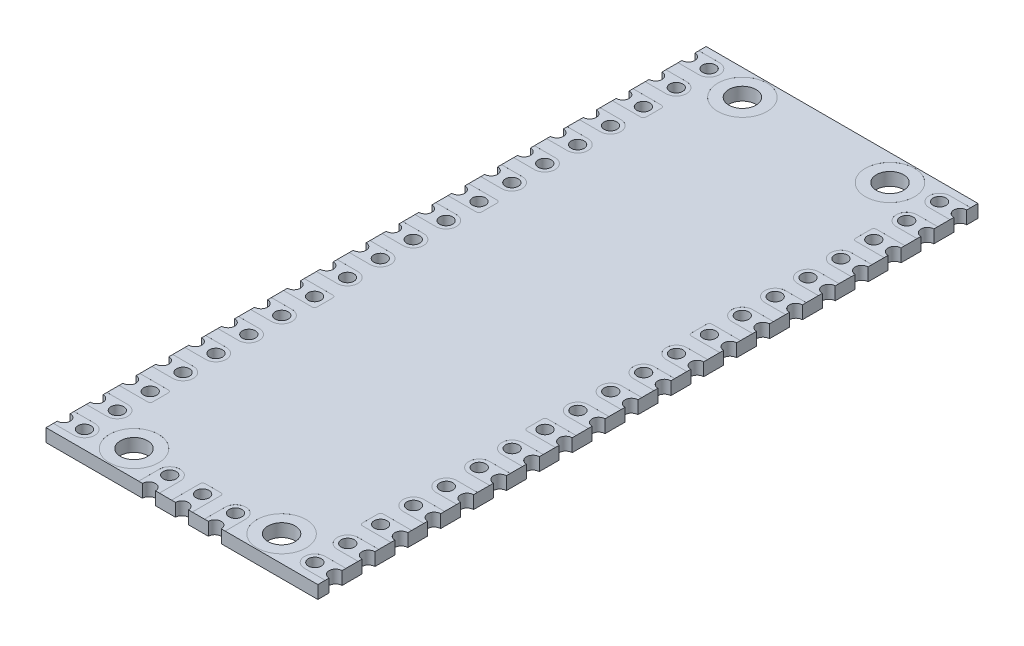
from build123d import *

# Parameters (mm, degrees)
BASES_W                        = 21
BASES_H                        = 51
BASE_DEPTH                     = 0.5
F_1_0_1_DIAMETER_HOLE1_D       = 1
HOLEHORZLP_COUNT               = 2
HOLEHORZLP_PITCH               = 1.6
SLOTCUT_DEPTH                  = 0.001
HOLEHORZLPSLOTLP_COUNT         = 20
HOLEHORZLPSLOTLP_PITCH         = 2.54
HOLEHORZLPSLOTLP_COPY_1_D      = 1
HOLEHORZLPSLOTLP_COPY_2_D      = 1
HOLEHORZLPSLOTLP_COPY_3_D      = 1
HOLEHORZLPSLOTLP_COPY_4_D      = 1
HOLEHORZLPSLOTLP_COPY_5_D      = 1
HOLEHORZLPSLOTLP_COPY_6_D      = 1
HOLEHORZLPSLOTLP_COPY_7_D      = 1
HOLEHORZLPSLOTLP_COPY_8_D      = 1
HOLEHORZLPSLOTLP_COPY_9_D      = 1
HOLEHORZLPSLOTLP_COPY_10_D     = 1
HOLEHORZLPSLOTLP_COPY_11_D     = 1
HOLEHORZLPSLOTLP_COPY_12_D     = 1
HOLEHORZLPSLOTLP_COPY_13_D     = 1
HOLEHORZLPSLOTLP_COPY_14_D     = 1
HOLEHORZLPSLOTLP_COPY_15_D     = 1
HOLEHORZLPSLOTLP_COPY_16_D     = 1
HOLEHORZLPSLOTLP_COPY_17_D     = 1
HOLEHORZLPSLOTLP_COPY_18_D     = 1
HOLEHORZLPSLOTLP_COPY_19_D     = 1
SHLPHM_COPY_1_D                = 1
SHLPHM_COPY_2_D                = 1
SHLPHM_COPY_3_D                = 1
SHLPHM_COPY_4_D                = 1
SHLPHM_COPY_5_D                = 1
SHLPHM_COPY_6_D                = 1
SHLPHM_COPY_7_D                = 1
SHLPHM_COPY_8_D                = 1
SHLPHM_COPY_9_D                = 1
SHLPHM_COPY_10_D               = 1
SHLPHM_COPY_11_D               = 1
SHLPHM_COPY_12_D               = 1
SHLPHM_COPY_13_D               = 1
SHLPHM_COPY_14_D               = 1
SHLPHM_COPY_15_D               = 1
SHLPHM_COPY_16_D               = 1
SHLPHM_COPY_17_D               = 1
SHLPHM_COPY_18_D               = 1
SHLPHM_COPY_19_D               = 1
SHLPHM_COPY_20_D               = 1
SHLPHM_COPY_21_DEPTH           = 0.001
SHLPHM_COPY_22_DEPTH           = 0.001
SHLPHM_COPY_23_DEPTH           = 0.001
SHLPHM_COPY_24_DEPTH           = 0.001
SHLPHM_COPY_25_DEPTH           = 0.001
SHLPHM_COPY_26_DEPTH           = 0.001
SHLPHM_COPY_27_DEPTH           = 0.001
SHLPHM_COPY_28_DEPTH           = 0.001
SHLPHM_COPY_29_DEPTH           = 0.001
SHLPHM_COPY_30_DEPTH           = 0.001
SHLPHM_COPY_31_DEPTH           = 0.001
SHLPHM_COPY_32_DEPTH           = 0.001
SHLPHM_COPY_33_DEPTH           = 0.001
SHLPHM_COPY_34_DEPTH           = 0.001
SHLPHM_COPY_35_DEPTH           = 0.001
SHLPHM_COPY_36_DEPTH           = 0.001
SHLPHM_COPY_37_DEPTH           = 0.001
SHLPHM_COPY_38_DEPTH           = 0.001
SHLPHM_COPY_39_DEPTH           = 0.001
SHLPHM_COPY_40_D               = 1
SHLPHM_COPY_41_D               = 1
SHLPHM_COPY_42_D               = 1
SHLPHM_COPY_43_D               = 1
SHLPHM_COPY_44_D               = 1
SHLPHM_COPY_45_D               = 1
SHLPHM_COPY_46_D               = 1
SHLPHM_COPY_47_D               = 1
SHLPHM_COPY_48_D               = 1
SHLPHM_COPY_49_D               = 1
SHLPHM_COPY_50_D               = 1
SHLPHM_COPY_51_D               = 1
SHLPHM_COPY_52_D               = 1
SHLPHM_COPY_53_D               = 1
SHLPHM_COPY_54_D               = 1
SHLPHM_COPY_55_D               = 1
SHLPHM_COPY_56_D               = 1
SHLPHM_COPY_57_D               = 1
SHLPHM_COPY_58_D               = 1
F_2_1_2_1_DIAMETER_HOLE1_D     = 2.1
SOLDERING2_1MMHOLECUTOUTS_R    = 1.9
SOLDERING2_1MMHOLECUTOUT_DEPTH = 0.001
SHCHMVM_COPY_1_D               = 2.1
SHCHMVM_COPY_2_SKETCH_R        = 1.9
SHCHMVM_COPY_2_DEPTH           = 0.001
SHCTOPVM_COPY_1_D              = 2.1
SHCTOPVM_COPY_2_SKETCH_R       = 1.9
SHCTOPVM_COPY_2_DEPTH          = 0.001
SHCTOPVM_COPY_3_D              = 2.1
SHCTOPVM_COPY_4_D              = 2.1
SHCTOPVM_COPY_5_SKETCH_R       = 1.9
SHCTOPVM_COPY_5_DEPTH          = 0.001
SHCTOPVM_COPY_6_D              = 2.1
SHCTOPVM_COPY_7_SKETCH_R       = 1.9
SHCTOPVM_COPY_7_DEPTH          = 0.001
SHCTOPVM_COPY_8_D              = 2.1
SQUAREETCH_DEPTH               = 0.001
SELP_COUNT                     = 4
SELP_PITCH                     = 12.7
SELPHM_COPY_1_DEPTH            = 0.001
SELPHM_COPY_2_DEPTH            = 0.001
SELPHM_COPY_3_DEPTH            = 0.001
F_1_0_1_DIAMETER_HOLE2_D       = 1
VERTICALSLOTCUT_START          = -0.001
VERTICALSLOTCUT_DEPTH          = 0.001
DH2LP_COUNT                    = 2
DH2LP_PITCH                    = 1.6
VSCHLP_COUNT                   = 2
VSCHLP_PITCH                   = 2.54
VSCHLP_COPY_1_D                = 1
VSCHLP_COL_COUNT               = 2
VSCHLP_COL_PITCH               = 2.54
VSCHLP_COL_COPY_1_D            = 1
VERTICALSQUAREETCH_DEPTH       = 0.001
VSCHPVM_DEPTH                  = 0.001


with BuildPart() as part:
    # BaseS → Base (new, symmetric)
    with BuildSketch(Plane(origin=(0, 0, 0), x_dir=(1, 0, 0), z_dir=(0, 1, 0))):
        Rectangle(BASES_W, BASES_H)
    extrude(amount=BASE_DEPTH, both=True)

    # Ø1.0 (1) Diameter Hole1 (through all)
    with Locations(Plane(origin=(0, 0.5, 0), x_dir=(1, 0, 0), z_dir=(0, 1, 0))):
        with Locations((-8.9, -24.13)):
            f_1_0_1_diameter_hole1 = Hole(F_1_0_1_DIAMETER_HOLE1_D / 2)

    # HoleHorzLP: Ø1.0 (1) Diameter Hole1 ×2
    with Locations(*[(-i * HOLEHORZLP_PITCH, 0, 0) for i in range(1, HOLEHORZLP_COUNT)]):
        add(f_1_0_1_diameter_hole1, mode=Mode.SUBTRACT)

    # SlotCutS → SlotCut (cut)
    with BuildSketch(Plane(origin=(0, 0.5, 0), x_dir=(1, 0, 0), z_dir=(0, 1, 0))):
        with BuildLine():
            Line((-8.9, -24.93), (-10.5, -24.93))
            ThreePointArc((-10.5, -24.93), (-11.3, -24.13), (-10.5, -23.33))
            Line((-10.5, -23.33), (-8.9, -23.33))
            ThreePointArc((-8.9, -23.33), (-8.1, -24.13), (-8.9, -24.93))
        make_face()
    slotcut = extrude(amount=-SLOTCUT_DEPTH, mode=Mode.SUBTRACT)

    # HoleHorzLPSlotLP: Ø1.0 (1) Diameter Hole1, SlotCut ×20
    with Locations(*[(0, 0, -i * HOLEHORZLPSLOTLP_PITCH) for i in range(1, HOLEHORZLPSLOTLP_COUNT)]):
        add(f_1_0_1_diameter_hole1, mode=Mode.SUBTRACT)
        add(slotcut, mode=Mode.SUBTRACT)

    # HoleHorzLPSlotLP copy 1 (through all)
    with Locations(Plane(origin=(-1.6, 0.5, -2.54), x_dir=(1, 0, 0), z_dir=(0, 1, 0))):
        with Locations((-8.9, -24.13)):
            Hole(HOLEHORZLPSLOTLP_COPY_1_D / 2)

    # HoleHorzLPSlotLP copy 2 (through all)
    with Locations(Plane(origin=(-1.6, 0.5, -5.08), x_dir=(1, 0, 0), z_dir=(0, 1, 0))):
        with Locations((-8.9, -24.13)):
            Hole(HOLEHORZLPSLOTLP_COPY_2_D / 2)

    # HoleHorzLPSlotLP copy 3 (through all)
    with Locations(Plane(origin=(-1.6, 0.5, -7.62), x_dir=(1, 0, 0), z_dir=(0, 1, 0))):
        with Locations((-8.9, -24.13)):
            Hole(HOLEHORZLPSLOTLP_COPY_3_D / 2)

    # HoleHorzLPSlotLP copy 4 (through all)
    with Locations(Plane(origin=(-1.6, 0.5, -10.16), x_dir=(1, 0, 0), z_dir=(0, 1, 0))):
        with Locations((-8.9, -24.13)):
            Hole(HOLEHORZLPSLOTLP_COPY_4_D / 2)

    # HoleHorzLPSlotLP copy 5 (through all)
    with Locations(Plane(origin=(-1.6, 0.5, -12.7), x_dir=(1, 0, 0), z_dir=(0, 1, 0))):
        with Locations((-8.9, -24.13)):
            Hole(HOLEHORZLPSLOTLP_COPY_5_D / 2)

    # HoleHorzLPSlotLP copy 6 (through all)
    with Locations(Plane(origin=(-1.6, 0.5, -15.24), x_dir=(1, 0, 0), z_dir=(0, 1, 0))):
        with Locations((-8.9, -24.13)):
            Hole(HOLEHORZLPSLOTLP_COPY_6_D / 2)

    # HoleHorzLPSlotLP copy 7 (through all)
    with Locations(Plane(origin=(-1.6, 0.5, -17.78), x_dir=(1, 0, 0), z_dir=(0, 1, 0))):
        with Locations((-8.9, -24.13)):
            Hole(HOLEHORZLPSLOTLP_COPY_7_D / 2)

    # HoleHorzLPSlotLP copy 8 (through all)
    with Locations(Plane(origin=(-1.6, 0.5, -20.32), x_dir=(1, 0, 0), z_dir=(0, 1, 0))):
        with Locations((-8.9, -24.13)):
            Hole(HOLEHORZLPSLOTLP_COPY_8_D / 2)

    # HoleHorzLPSlotLP copy 9 (through all)
    with Locations(Plane(origin=(-1.6, 0.5, -22.86), x_dir=(1, 0, 0), z_dir=(0, 1, 0))):
        with Locations((-8.9, -24.13)):
            Hole(HOLEHORZLPSLOTLP_COPY_9_D / 2)

    # HoleHorzLPSlotLP copy 10 (through all)
    with Locations(Plane(origin=(-1.6, 0.5, -25.4), x_dir=(1, 0, 0), z_dir=(0, 1, 0))):
        with Locations((-8.9, -24.13)):
            Hole(HOLEHORZLPSLOTLP_COPY_10_D / 2)

    # HoleHorzLPSlotLP copy 11 (through all)
    with Locations(Plane(origin=(-1.6, 0.5, -27.94), x_dir=(1, 0, 0), z_dir=(0, 1, 0))):
        with Locations((-8.9, -24.13)):
            Hole(HOLEHORZLPSLOTLP_COPY_11_D / 2)

    # HoleHorzLPSlotLP copy 12 (through all)
    with Locations(Plane(origin=(-1.6, 0.5, -30.48), x_dir=(1, 0, 0), z_dir=(0, 1, 0))):
        with Locations((-8.9, -24.13)):
            Hole(HOLEHORZLPSLOTLP_COPY_12_D / 2)

    # HoleHorzLPSlotLP copy 13 (through all)
    with Locations(Plane(origin=(-1.6, 0.5, -33.02), x_dir=(1, 0, 0), z_dir=(0, 1, 0))):
        with Locations((-8.9, -24.13)):
            Hole(HOLEHORZLPSLOTLP_COPY_13_D / 2)

    # HoleHorzLPSlotLP copy 14 (through all)
    with Locations(Plane(origin=(-1.6, 0.5, -35.56), x_dir=(1, 0, 0), z_dir=(0, 1, 0))):
        with Locations((-8.9, -24.13)):
            Hole(HOLEHORZLPSLOTLP_COPY_14_D / 2)

    # HoleHorzLPSlotLP copy 15 (through all)
    with Locations(Plane(origin=(-1.6, 0.5, -38.1), x_dir=(1, 0, 0), z_dir=(0, 1, 0))):
        with Locations((-8.9, -24.13)):
            Hole(HOLEHORZLPSLOTLP_COPY_15_D / 2)

    # HoleHorzLPSlotLP copy 16 (through all)
    with Locations(Plane(origin=(-1.6, 0.5, -40.64), x_dir=(1, 0, 0), z_dir=(0, 1, 0))):
        with Locations((-8.9, -24.13)):
            Hole(HOLEHORZLPSLOTLP_COPY_16_D / 2)

    # HoleHorzLPSlotLP copy 17 (through all)
    with Locations(Plane(origin=(-1.6, 0.5, -43.18), x_dir=(1, 0, 0), z_dir=(0, 1, 0))):
        with Locations((-8.9, -24.13)):
            Hole(HOLEHORZLPSLOTLP_COPY_17_D / 2)

    # HoleHorzLPSlotLP copy 18 (through all)
    with Locations(Plane(origin=(-1.6, 0.5, -45.72), x_dir=(1, 0, 0), z_dir=(0, 1, 0))):
        with Locations((-8.9, -24.13)):
            Hole(HOLEHORZLPSLOTLP_COPY_18_D / 2)

    # HoleHorzLPSlotLP copy 19 (through all)
    with Locations(Plane(origin=(-1.6, 0.5, -48.26), x_dir=(1, 0, 0), z_dir=(0, 1, 0))):
        with Locations((-8.9, -24.13)):
            Hole(HOLEHORZLPSLOTLP_COPY_19_D / 2)

    # SHLPHM: Ø1.0 (1) Diameter Hole1, SlotCut across plane
    add(f_1_0_1_diameter_hole1.mirror(Plane(origin=(0, 0, 0), x_dir=(0, 0, 1), z_dir=(1, 0, 0))), mode=Mode.SUBTRACT)
    add(slotcut.mirror(Plane(origin=(0, 0, 0), x_dir=(0, 0, 1), z_dir=(1, 0, 0))), mode=Mode.SUBTRACT)

    # SHLPHM copy 1 (through all)
    with Locations(Plane(origin=(1.6, 0.5, 0), x_dir=(-1, 0, 0), z_dir=(0, 1, 0))):
        with Locations((-8.9, 24.13)):
            Hole(SHLPHM_COPY_1_D / 2)

    # SHLPHM copy 2 (through all)
    with Locations(Plane(origin=(0, 0.5, -2.54), x_dir=(-1, 0, 0), z_dir=(0, 1, 0))):
        with Locations((-8.9, 24.13)):
            Hole(SHLPHM_COPY_2_D / 2)

    # SHLPHM copy 3 (through all)
    with Locations(Plane(origin=(0, 0.5, -5.08), x_dir=(-1, 0, 0), z_dir=(0, 1, 0))):
        with Locations((-8.9, 24.13)):
            Hole(SHLPHM_COPY_3_D / 2)

    # SHLPHM copy 4 (through all)
    with Locations(Plane(origin=(0, 0.5, -7.62), x_dir=(-1, 0, 0), z_dir=(0, 1, 0))):
        with Locations((-8.9, 24.13)):
            Hole(SHLPHM_COPY_4_D / 2)

    # SHLPHM copy 5 (through all)
    with Locations(Plane(origin=(0, 0.5, -10.16), x_dir=(-1, 0, 0), z_dir=(0, 1, 0))):
        with Locations((-8.9, 24.13)):
            Hole(SHLPHM_COPY_5_D / 2)

    # SHLPHM copy 6 (through all)
    with Locations(Plane(origin=(0, 0.5, -12.7), x_dir=(-1, 0, 0), z_dir=(0, 1, 0))):
        with Locations((-8.9, 24.13)):
            Hole(SHLPHM_COPY_6_D / 2)

    # SHLPHM copy 7 (through all)
    with Locations(Plane(origin=(0, 0.5, -15.24), x_dir=(-1, 0, 0), z_dir=(0, 1, 0))):
        with Locations((-8.9, 24.13)):
            Hole(SHLPHM_COPY_7_D / 2)

    # SHLPHM copy 8 (through all)
    with Locations(Plane(origin=(0, 0.5, -17.78), x_dir=(-1, 0, 0), z_dir=(0, 1, 0))):
        with Locations((-8.9, 24.13)):
            Hole(SHLPHM_COPY_8_D / 2)

    # SHLPHM copy 9 (through all)
    with Locations(Plane(origin=(0, 0.5, -20.32), x_dir=(-1, 0, 0), z_dir=(0, 1, 0))):
        with Locations((-8.9, 24.13)):
            Hole(SHLPHM_COPY_9_D / 2)

    # SHLPHM copy 10 (through all)
    with Locations(Plane(origin=(0, 0.5, -22.86), x_dir=(-1, 0, 0), z_dir=(0, 1, 0))):
        with Locations((-8.9, 24.13)):
            Hole(SHLPHM_COPY_10_D / 2)

    # SHLPHM copy 11 (through all)
    with Locations(Plane(origin=(0, 0.5, -25.4), x_dir=(-1, 0, 0), z_dir=(0, 1, 0))):
        with Locations((-8.9, 24.13)):
            Hole(SHLPHM_COPY_11_D / 2)

    # SHLPHM copy 12 (through all)
    with Locations(Plane(origin=(0, 0.5, -27.94), x_dir=(-1, 0, 0), z_dir=(0, 1, 0))):
        with Locations((-8.9, 24.13)):
            Hole(SHLPHM_COPY_12_D / 2)

    # SHLPHM copy 13 (through all)
    with Locations(Plane(origin=(0, 0.5, -30.48), x_dir=(-1, 0, 0), z_dir=(0, 1, 0))):
        with Locations((-8.9, 24.13)):
            Hole(SHLPHM_COPY_13_D / 2)

    # SHLPHM copy 14 (through all)
    with Locations(Plane(origin=(0, 0.5, -33.02), x_dir=(-1, 0, 0), z_dir=(0, 1, 0))):
        with Locations((-8.9, 24.13)):
            Hole(SHLPHM_COPY_14_D / 2)

    # SHLPHM copy 15 (through all)
    with Locations(Plane(origin=(0, 0.5, -35.56), x_dir=(-1, 0, 0), z_dir=(0, 1, 0))):
        with Locations((-8.9, 24.13)):
            Hole(SHLPHM_COPY_15_D / 2)

    # SHLPHM copy 16 (through all)
    with Locations(Plane(origin=(0, 0.5, -38.1), x_dir=(-1, 0, 0), z_dir=(0, 1, 0))):
        with Locations((-8.9, 24.13)):
            Hole(SHLPHM_COPY_16_D / 2)

    # SHLPHM copy 17 (through all)
    with Locations(Plane(origin=(0, 0.5, -40.64), x_dir=(-1, 0, 0), z_dir=(0, 1, 0))):
        with Locations((-8.9, 24.13)):
            Hole(SHLPHM_COPY_17_D / 2)

    # SHLPHM copy 18 (through all)
    with Locations(Plane(origin=(0, 0.5, -43.18), x_dir=(-1, 0, 0), z_dir=(0, 1, 0))):
        with Locations((-8.9, 24.13)):
            Hole(SHLPHM_COPY_18_D / 2)

    # SHLPHM copy 19 (through all)
    with Locations(Plane(origin=(0, 0.5, -45.72), x_dir=(-1, 0, 0), z_dir=(0, 1, 0))):
        with Locations((-8.9, 24.13)):
            Hole(SHLPHM_COPY_19_D / 2)

    # SHLPHM copy 20 (through all)
    with Locations(Plane(origin=(0, 0.5, -48.26), x_dir=(-1, 0, 0), z_dir=(0, 1, 0))):
        with Locations((-8.9, 24.13)):
            Hole(SHLPHM_COPY_20_D / 2)

    # SHLPHM copy 21 sketch → SHLPHM copy 21 (cut)
    with BuildSketch(Plane(origin=(0, 0.5, -2.54), x_dir=(-1, 0, 0), z_dir=(0, 1, 0))):
        with BuildLine():
            Line((-8.9, 24.93), (-10.5, 24.93))
            ThreePointArc((-10.5, 24.93), (-11.3, 24.13), (-10.5, 23.33))
            Line((-10.5, 23.33), (-8.9, 23.33))
            ThreePointArc((-8.9, 23.33), (-8.1, 24.13), (-8.9, 24.93))
        make_face()
    extrude(amount=-SHLPHM_COPY_21_DEPTH, mode=Mode.SUBTRACT)

    # SHLPHM copy 22 sketch → SHLPHM copy 22 (cut)
    with BuildSketch(Plane(origin=(0, 0.5, -5.08), x_dir=(-1, 0, 0), z_dir=(0, 1, 0))):
        with BuildLine():
            Line((-8.9, 24.93), (-10.5, 24.93))
            ThreePointArc((-10.5, 24.93), (-11.3, 24.13), (-10.5, 23.33))
            Line((-10.5, 23.33), (-8.9, 23.33))
            ThreePointArc((-8.9, 23.33), (-8.1, 24.13), (-8.9, 24.93))
        make_face()
    extrude(amount=-SHLPHM_COPY_22_DEPTH, mode=Mode.SUBTRACT)

    # SHLPHM copy 23 sketch → SHLPHM copy 23 (cut)
    with BuildSketch(Plane(origin=(0, 0.5, -7.62), x_dir=(-1, 0, 0), z_dir=(0, 1, 0))):
        with BuildLine():
            Line((-8.9, 24.93), (-10.5, 24.93))
            ThreePointArc((-10.5, 24.93), (-11.3, 24.13), (-10.5, 23.33))
            Line((-10.5, 23.33), (-8.9, 23.33))
            ThreePointArc((-8.9, 23.33), (-8.1, 24.13), (-8.9, 24.93))
        make_face()
    extrude(amount=-SHLPHM_COPY_23_DEPTH, mode=Mode.SUBTRACT)

    # SHLPHM copy 24 sketch → SHLPHM copy 24 (cut)
    with BuildSketch(Plane(origin=(0, 0.5, -10.16), x_dir=(-1, 0, 0), z_dir=(0, 1, 0))):
        with BuildLine():
            Line((-8.9, 24.93), (-10.5, 24.93))
            ThreePointArc((-10.5, 24.93), (-11.3, 24.13), (-10.5, 23.33))
            Line((-10.5, 23.33), (-8.9, 23.33))
            ThreePointArc((-8.9, 23.33), (-8.1, 24.13), (-8.9, 24.93))
        make_face()
    extrude(amount=-SHLPHM_COPY_24_DEPTH, mode=Mode.SUBTRACT)

    # SHLPHM copy 25 sketch → SHLPHM copy 25 (cut)
    with BuildSketch(Plane(origin=(0, 0.5, -12.7), x_dir=(-1, 0, 0), z_dir=(0, 1, 0))):
        with BuildLine():
            Line((-8.9, 24.93), (-10.5, 24.93))
            ThreePointArc((-10.5, 24.93), (-11.3, 24.13), (-10.5, 23.33))
            Line((-10.5, 23.33), (-8.9, 23.33))
            ThreePointArc((-8.9, 23.33), (-8.1, 24.13), (-8.9, 24.93))
        make_face()
    extrude(amount=-SHLPHM_COPY_25_DEPTH, mode=Mode.SUBTRACT)

    # SHLPHM copy 26 sketch → SHLPHM copy 26 (cut)
    with BuildSketch(Plane(origin=(0, 0.5, -15.24), x_dir=(-1, 0, 0), z_dir=(0, 1, 0))):
        with BuildLine():
            Line((-8.9, 24.93), (-10.5, 24.93))
            ThreePointArc((-10.5, 24.93), (-11.3, 24.13), (-10.5, 23.33))
            Line((-10.5, 23.33), (-8.9, 23.33))
            ThreePointArc((-8.9, 23.33), (-8.1, 24.13), (-8.9, 24.93))
        make_face()
    extrude(amount=-SHLPHM_COPY_26_DEPTH, mode=Mode.SUBTRACT)

    # SHLPHM copy 27 sketch → SHLPHM copy 27 (cut)
    with BuildSketch(Plane(origin=(0, 0.5, -17.78), x_dir=(-1, 0, 0), z_dir=(0, 1, 0))):
        with BuildLine():
            Line((-8.9, 24.93), (-10.5, 24.93))
            ThreePointArc((-10.5, 24.93), (-11.3, 24.13), (-10.5, 23.33))
            Line((-10.5, 23.33), (-8.9, 23.33))
            ThreePointArc((-8.9, 23.33), (-8.1, 24.13), (-8.9, 24.93))
        make_face()
    extrude(amount=-SHLPHM_COPY_27_DEPTH, mode=Mode.SUBTRACT)

    # SHLPHM copy 28 sketch → SHLPHM copy 28 (cut)
    with BuildSketch(Plane(origin=(0, 0.5, -20.32), x_dir=(-1, 0, 0), z_dir=(0, 1, 0))):
        with BuildLine():
            Line((-8.9, 24.93), (-10.5, 24.93))
            ThreePointArc((-10.5, 24.93), (-11.3, 24.13), (-10.5, 23.33))
            Line((-10.5, 23.33), (-8.9, 23.33))
            ThreePointArc((-8.9, 23.33), (-8.1, 24.13), (-8.9, 24.93))
        make_face()
    extrude(amount=-SHLPHM_COPY_28_DEPTH, mode=Mode.SUBTRACT)

    # SHLPHM copy 29 sketch → SHLPHM copy 29 (cut)
    with BuildSketch(Plane(origin=(0, 0.5, -22.86), x_dir=(-1, 0, 0), z_dir=(0, 1, 0))):
        with BuildLine():
            Line((-8.9, 24.93), (-10.5, 24.93))
            ThreePointArc((-10.5, 24.93), (-11.3, 24.13), (-10.5, 23.33))
            Line((-10.5, 23.33), (-8.9, 23.33))
            ThreePointArc((-8.9, 23.33), (-8.1, 24.13), (-8.9, 24.93))
        make_face()
    extrude(amount=-SHLPHM_COPY_29_DEPTH, mode=Mode.SUBTRACT)

    # SHLPHM copy 30 sketch → SHLPHM copy 30 (cut)
    with BuildSketch(Plane(origin=(0, 0.5, -25.4), x_dir=(-1, 0, 0), z_dir=(0, 1, 0))):
        with BuildLine():
            Line((-8.9, 24.93), (-10.5, 24.93))
            ThreePointArc((-10.5, 24.93), (-11.3, 24.13), (-10.5, 23.33))
            Line((-10.5, 23.33), (-8.9, 23.33))
            ThreePointArc((-8.9, 23.33), (-8.1, 24.13), (-8.9, 24.93))
        make_face()
    extrude(amount=-SHLPHM_COPY_30_DEPTH, mode=Mode.SUBTRACT)

    # SHLPHM copy 31 sketch → SHLPHM copy 31 (cut)
    with BuildSketch(Plane(origin=(0, 0.5, -27.94), x_dir=(-1, 0, 0), z_dir=(0, 1, 0))):
        with BuildLine():
            Line((-8.9, 24.93), (-10.5, 24.93))
            ThreePointArc((-10.5, 24.93), (-11.3, 24.13), (-10.5, 23.33))
            Line((-10.5, 23.33), (-8.9, 23.33))
            ThreePointArc((-8.9, 23.33), (-8.1, 24.13), (-8.9, 24.93))
        make_face()
    extrude(amount=-SHLPHM_COPY_31_DEPTH, mode=Mode.SUBTRACT)

    # SHLPHM copy 32 sketch → SHLPHM copy 32 (cut)
    with BuildSketch(Plane(origin=(0, 0.5, -30.48), x_dir=(-1, 0, 0), z_dir=(0, 1, 0))):
        with BuildLine():
            Line((-8.9, 24.93), (-10.5, 24.93))
            ThreePointArc((-10.5, 24.93), (-11.3, 24.13), (-10.5, 23.33))
            Line((-10.5, 23.33), (-8.9, 23.33))
            ThreePointArc((-8.9, 23.33), (-8.1, 24.13), (-8.9, 24.93))
        make_face()
    extrude(amount=-SHLPHM_COPY_32_DEPTH, mode=Mode.SUBTRACT)

    # SHLPHM copy 33 sketch → SHLPHM copy 33 (cut)
    with BuildSketch(Plane(origin=(0, 0.5, -33.02), x_dir=(-1, 0, 0), z_dir=(0, 1, 0))):
        with BuildLine():
            Line((-8.9, 24.93), (-10.5, 24.93))
            ThreePointArc((-10.5, 24.93), (-11.3, 24.13), (-10.5, 23.33))
            Line((-10.5, 23.33), (-8.9, 23.33))
            ThreePointArc((-8.9, 23.33), (-8.1, 24.13), (-8.9, 24.93))
        make_face()
    extrude(amount=-SHLPHM_COPY_33_DEPTH, mode=Mode.SUBTRACT)

    # SHLPHM copy 34 sketch → SHLPHM copy 34 (cut)
    with BuildSketch(Plane(origin=(0, 0.5, -35.56), x_dir=(-1, 0, 0), z_dir=(0, 1, 0))):
        with BuildLine():
            Line((-8.9, 24.93), (-10.5, 24.93))
            ThreePointArc((-10.5, 24.93), (-11.3, 24.13), (-10.5, 23.33))
            Line((-10.5, 23.33), (-8.9, 23.33))
            ThreePointArc((-8.9, 23.33), (-8.1, 24.13), (-8.9, 24.93))
        make_face()
    extrude(amount=-SHLPHM_COPY_34_DEPTH, mode=Mode.SUBTRACT)

    # SHLPHM copy 35 sketch → SHLPHM copy 35 (cut)
    with BuildSketch(Plane(origin=(0, 0.5, -38.1), x_dir=(-1, 0, 0), z_dir=(0, 1, 0))):
        with BuildLine():
            Line((-8.9, 24.93), (-10.5, 24.93))
            ThreePointArc((-10.5, 24.93), (-11.3, 24.13), (-10.5, 23.33))
            Line((-10.5, 23.33), (-8.9, 23.33))
            ThreePointArc((-8.9, 23.33), (-8.1, 24.13), (-8.9, 24.93))
        make_face()
    extrude(amount=-SHLPHM_COPY_35_DEPTH, mode=Mode.SUBTRACT)

    # SHLPHM copy 36 sketch → SHLPHM copy 36 (cut)
    with BuildSketch(Plane(origin=(0, 0.5, -40.64), x_dir=(-1, 0, 0), z_dir=(0, 1, 0))):
        with BuildLine():
            Line((-8.9, 24.93), (-10.5, 24.93))
            ThreePointArc((-10.5, 24.93), (-11.3, 24.13), (-10.5, 23.33))
            Line((-10.5, 23.33), (-8.9, 23.33))
            ThreePointArc((-8.9, 23.33), (-8.1, 24.13), (-8.9, 24.93))
        make_face()
    extrude(amount=-SHLPHM_COPY_36_DEPTH, mode=Mode.SUBTRACT)

    # SHLPHM copy 37 sketch → SHLPHM copy 37 (cut)
    with BuildSketch(Plane(origin=(0, 0.5, -43.18), x_dir=(-1, 0, 0), z_dir=(0, 1, 0))):
        with BuildLine():
            Line((-8.9, 24.93), (-10.5, 24.93))
            ThreePointArc((-10.5, 24.93), (-11.3, 24.13), (-10.5, 23.33))
            Line((-10.5, 23.33), (-8.9, 23.33))
            ThreePointArc((-8.9, 23.33), (-8.1, 24.13), (-8.9, 24.93))
        make_face()
    extrude(amount=-SHLPHM_COPY_37_DEPTH, mode=Mode.SUBTRACT)

    # SHLPHM copy 38 sketch → SHLPHM copy 38 (cut)
    with BuildSketch(Plane(origin=(0, 0.5, -45.72), x_dir=(-1, 0, 0), z_dir=(0, 1, 0))):
        with BuildLine():
            Line((-8.9, 24.93), (-10.5, 24.93))
            ThreePointArc((-10.5, 24.93), (-11.3, 24.13), (-10.5, 23.33))
            Line((-10.5, 23.33), (-8.9, 23.33))
            ThreePointArc((-8.9, 23.33), (-8.1, 24.13), (-8.9, 24.93))
        make_face()
    extrude(amount=-SHLPHM_COPY_38_DEPTH, mode=Mode.SUBTRACT)

    # SHLPHM copy 39 sketch → SHLPHM copy 39 (cut)
    with BuildSketch(Plane(origin=(0, 0.5, -48.26), x_dir=(-1, 0, 0), z_dir=(0, 1, 0))):
        with BuildLine():
            Line((-8.9, 24.93), (-10.5, 24.93))
            ThreePointArc((-10.5, 24.93), (-11.3, 24.13), (-10.5, 23.33))
            Line((-10.5, 23.33), (-8.9, 23.33))
            ThreePointArc((-8.9, 23.33), (-8.1, 24.13), (-8.9, 24.93))
        make_face()
    extrude(amount=-SHLPHM_COPY_39_DEPTH, mode=Mode.SUBTRACT)

    # SHLPHM copy 40 (through all)
    with Locations(Plane(origin=(1.6, 0.5, -2.54), x_dir=(-1, 0, 0), z_dir=(0, 1, 0))):
        with Locations((-8.9, 24.13)):
            Hole(SHLPHM_COPY_40_D / 2)

    # SHLPHM copy 41 (through all)
    with Locations(Plane(origin=(1.6, 0.5, -5.08), x_dir=(-1, 0, 0), z_dir=(0, 1, 0))):
        with Locations((-8.9, 24.13)):
            Hole(SHLPHM_COPY_41_D / 2)

    # SHLPHM copy 42 (through all)
    with Locations(Plane(origin=(1.6, 0.5, -7.62), x_dir=(-1, 0, 0), z_dir=(0, 1, 0))):
        with Locations((-8.9, 24.13)):
            Hole(SHLPHM_COPY_42_D / 2)

    # SHLPHM copy 43 (through all)
    with Locations(Plane(origin=(1.6, 0.5, -10.16), x_dir=(-1, 0, 0), z_dir=(0, 1, 0))):
        with Locations((-8.9, 24.13)):
            Hole(SHLPHM_COPY_43_D / 2)

    # SHLPHM copy 44 (through all)
    with Locations(Plane(origin=(1.6, 0.5, -12.7), x_dir=(-1, 0, 0), z_dir=(0, 1, 0))):
        with Locations((-8.9, 24.13)):
            Hole(SHLPHM_COPY_44_D / 2)

    # SHLPHM copy 45 (through all)
    with Locations(Plane(origin=(1.6, 0.5, -15.24), x_dir=(-1, 0, 0), z_dir=(0, 1, 0))):
        with Locations((-8.9, 24.13)):
            Hole(SHLPHM_COPY_45_D / 2)

    # SHLPHM copy 46 (through all)
    with Locations(Plane(origin=(1.6, 0.5, -17.78), x_dir=(-1, 0, 0), z_dir=(0, 1, 0))):
        with Locations((-8.9, 24.13)):
            Hole(SHLPHM_COPY_46_D / 2)

    # SHLPHM copy 47 (through all)
    with Locations(Plane(origin=(1.6, 0.5, -20.32), x_dir=(-1, 0, 0), z_dir=(0, 1, 0))):
        with Locations((-8.9, 24.13)):
            Hole(SHLPHM_COPY_47_D / 2)

    # SHLPHM copy 48 (through all)
    with Locations(Plane(origin=(1.6, 0.5, -22.86), x_dir=(-1, 0, 0), z_dir=(0, 1, 0))):
        with Locations((-8.9, 24.13)):
            Hole(SHLPHM_COPY_48_D / 2)

    # SHLPHM copy 49 (through all)
    with Locations(Plane(origin=(1.6, 0.5, -25.4), x_dir=(-1, 0, 0), z_dir=(0, 1, 0))):
        with Locations((-8.9, 24.13)):
            Hole(SHLPHM_COPY_49_D / 2)

    # SHLPHM copy 50 (through all)
    with Locations(Plane(origin=(1.6, 0.5, -27.94), x_dir=(-1, 0, 0), z_dir=(0, 1, 0))):
        with Locations((-8.9, 24.13)):
            Hole(SHLPHM_COPY_50_D / 2)

    # SHLPHM copy 51 (through all)
    with Locations(Plane(origin=(1.6, 0.5, -30.48), x_dir=(-1, 0, 0), z_dir=(0, 1, 0))):
        with Locations((-8.9, 24.13)):
            Hole(SHLPHM_COPY_51_D / 2)

    # SHLPHM copy 52 (through all)
    with Locations(Plane(origin=(1.6, 0.5, -33.02), x_dir=(-1, 0, 0), z_dir=(0, 1, 0))):
        with Locations((-8.9, 24.13)):
            Hole(SHLPHM_COPY_52_D / 2)

    # SHLPHM copy 53 (through all)
    with Locations(Plane(origin=(1.6, 0.5, -35.56), x_dir=(-1, 0, 0), z_dir=(0, 1, 0))):
        with Locations((-8.9, 24.13)):
            Hole(SHLPHM_COPY_53_D / 2)

    # SHLPHM copy 54 (through all)
    with Locations(Plane(origin=(1.6, 0.5, -38.1), x_dir=(-1, 0, 0), z_dir=(0, 1, 0))):
        with Locations((-8.9, 24.13)):
            Hole(SHLPHM_COPY_54_D / 2)

    # SHLPHM copy 55 (through all)
    with Locations(Plane(origin=(1.6, 0.5, -40.64), x_dir=(-1, 0, 0), z_dir=(0, 1, 0))):
        with Locations((-8.9, 24.13)):
            Hole(SHLPHM_COPY_55_D / 2)

    # SHLPHM copy 56 (through all)
    with Locations(Plane(origin=(1.6, 0.5, -43.18), x_dir=(-1, 0, 0), z_dir=(0, 1, 0))):
        with Locations((-8.9, 24.13)):
            Hole(SHLPHM_COPY_56_D / 2)

    # SHLPHM copy 57 (through all)
    with Locations(Plane(origin=(1.6, 0.5, -45.72), x_dir=(-1, 0, 0), z_dir=(0, 1, 0))):
        with Locations((-8.9, 24.13)):
            Hole(SHLPHM_COPY_57_D / 2)

    # SHLPHM copy 58 (through all)
    with Locations(Plane(origin=(1.6, 0.5, -48.26), x_dir=(-1, 0, 0), z_dir=(0, 1, 0))):
        with Locations((-8.9, 24.13)):
            Hole(SHLPHM_COPY_58_D / 2)

    # Ø2.1 (2.1) Diameter Hole1 (through all)
    with Locations(Plane(origin=(0, 0.5, 0), x_dir=(1, 0, 0), z_dir=(0, 1, 0))):
        with Locations((-5.7, -23.5)):
            f_2_1_2_1_diameter_hole1 = Hole(F_2_1_2_1_DIAMETER_HOLE1_D / 2)

    # Soldering2.1mmHoleCutoutS → Soldering2.1mmHoleCutout (cut)
    with BuildSketch(Plane(origin=(0, 0.5, 0), x_dir=(1, 0, 0), z_dir=(0, 1, 0))):
        with Locations(Location((-5.7, -23.5, 0), (0, 0, 270))):
            Circle(SOLDERING2_1MMHOLECUTOUTS_R)
    soldering2_1mmholecutout = extrude(amount=-SOLDERING2_1MMHOLECUTOUT_DEPTH, mode=Mode.SUBTRACT)

    # SHCHM: Ø2.1 (2.1) Diameter Hole1, Soldering2.1mmHoleCutout across plane
    add(f_2_1_2_1_diameter_hole1.mirror(Plane(origin=(0, 0, 0), x_dir=(0, 0, 1), z_dir=(1, 0, 0))), mode=Mode.SUBTRACT)
    add(soldering2_1mmholecutout.mirror(Plane(origin=(0, 0, 0), x_dir=(0, 0, 1), z_dir=(1, 0, 0))), mode=Mode.SUBTRACT)

    # SHCHMVM: Ø2.1 (2.1) Diameter Hole1, Soldering2.1mmHoleCutout across plane
    add(f_2_1_2_1_diameter_hole1.mirror(Plane.XY), mode=Mode.SUBTRACT)
    add(soldering2_1mmholecutout.mirror(Plane.XY), mode=Mode.SUBTRACT)

    # SHCHMVM copy 1 (through all)
    with Locations(Plane(origin=(0, 0.5, 0), x_dir=(-1, 0, 0), z_dir=(0, 1, 0))):
        with Locations((-5.7, -23.5)):
            Hole(SHCHMVM_COPY_1_D / 2)

    # SHCHMVM copy 2 sketch → SHCHMVM copy 2 (cut)
    with BuildSketch(Plane(origin=(0, 0.5, 0), x_dir=(-1, 0, 0), z_dir=(0, 1, 0))):
        with Locations(Location((-5.7, -23.5, 0), (0, 0, 270))):
            Circle(SHCHMVM_COPY_2_SKETCH_R)
    extrude(amount=-SHCHMVM_COPY_2_DEPTH, mode=Mode.SUBTRACT)

    # SHCTopVM: Soldering2.1mmHoleCutout across plane
    add(soldering2_1mmholecutout.mirror(Plane.ZX), mode=Mode.SUBTRACT)

    # SHCTopVM copy 1 (through all)
    with Locations(Plane(origin=(0, -0.5, 0), x_dir=(-1, 0, 0), z_dir=(0, -1, 0))):
        with Locations((-5.7, -23.5)):
            Hole(SHCTOPVM_COPY_1_D / 2)

    # SHCTopVM copy 2 sketch → SHCTopVM copy 2 (cut)
    with BuildSketch(Plane(origin=(0, -0.5, 0), x_dir=(-1, 0, 0), z_dir=(0, -1, 0))):
        with Locations(Location((-5.7, -23.5, 0), (0, 0, 270))):
            Circle(SHCTOPVM_COPY_2_SKETCH_R)
    extrude(amount=-SHCTOPVM_COPY_2_DEPTH, mode=Mode.SUBTRACT)

    # SHCTopVM copy 3 (through all)
    with Locations(Plane.XZ.offset(0.5)):
        with Locations((-5.7, 23.5)):
            Hole(SHCTOPVM_COPY_3_D / 2)

    # SHCTopVM copy 4 (through all)
    with Locations(Plane.XZ.offset(0.5)):
        with Locations((-5.7, -23.5)):
            Hole(SHCTOPVM_COPY_4_D / 2)

    # SHCTopVM copy 5 sketch → SHCTopVM copy 5 (cut)
    with BuildSketch(Plane.XZ.offset(0.5)):
        with Locations(Location((-5.7, -23.5, 0), (0, 0, 270))):
            Circle(SHCTOPVM_COPY_5_SKETCH_R)
    extrude(amount=-SHCTOPVM_COPY_5_DEPTH, mode=Mode.SUBTRACT)

    # SHCTopVM copy 6 (through all)
    with Locations(Plane(origin=(0, -0.5, 0), x_dir=(-1, 0, 0), z_dir=(0, -1, 0))):
        with Locations((-5.7, 23.5)):
            Hole(SHCTOPVM_COPY_6_D / 2)

    # SHCTopVM copy 7 sketch → SHCTopVM copy 7 (cut)
    with BuildSketch(Plane(origin=(0, -0.5, 0), x_dir=(-1, 0, 0), z_dir=(0, -1, 0))):
        with Locations((-5.7, 23.5)):
            Circle(SHCTOPVM_COPY_7_SKETCH_R)
    extrude(amount=-SHCTOPVM_COPY_7_DEPTH, mode=Mode.SUBTRACT)

    # SHCTopVM copy 8 (through all)
    with Locations(Plane.XZ.offset(0.5)):
        with Locations((-5.7, 23.5)):
            Hole(SHCTOPVM_COPY_8_D / 2)

    # SquareEtchS → SquareEtch (cut)
    with BuildSketch(Plane(origin=(0, 0.5, 0), x_dir=(1, 0, 0), z_dir=(0, 1, 0))):
        with BuildLine():
            Line((-10.5, -18.25), (-8.3, -18.25))
            ThreePointArc((-8.3, -18.25), (-8.158578644, -18.308578644), (-8.1, -18.45))
            Line((-8.1, -18.45), (-8.1, -19.65))
            ThreePointArc((-8.1, -19.65), (-8.158578644, -19.791421356), (-8.3, -19.85))
            Line((-8.3, -19.85), (-10.5, -19.85))
            Line((-10.5, -19.85), (-10.5, -18.25))
        make_face()
    squareetch = extrude(amount=-SQUAREETCH_DEPTH, mode=Mode.SUBTRACT)

    # SELP: SquareEtch ×4
    with Locations(*[(0, 0, -i * SELP_PITCH) for i in range(1, SELP_COUNT)]):
        add(squareetch, mode=Mode.SUBTRACT)

    # SELPHM: SquareEtch across plane
    add(squareetch.mirror(Plane(origin=(0, 0, 0), x_dir=(0, 0, 1), z_dir=(1, 0, 0))), mode=Mode.SUBTRACT)

    # SELPHM copy 1 sketch → SELPHM copy 1 (cut)
    with BuildSketch(Plane(origin=(0, 0.5, -12.7), x_dir=(-1, 0, 0), z_dir=(0, 1, 0))):
        with BuildLine():
            Line((-10.5, 18.25), (-8.3, 18.25))
            ThreePointArc((-8.3, 18.25), (-8.158578644, 18.308578644), (-8.1, 18.45))
            Line((-8.1, 18.45), (-8.1, 19.65))
            ThreePointArc((-8.1, 19.65), (-8.158578644, 19.791421356), (-8.3, 19.85))
            Line((-8.3, 19.85), (-10.5, 19.85))
            Line((-10.5, 19.85), (-10.5, 18.25))
        make_face()
    extrude(amount=-SELPHM_COPY_1_DEPTH, mode=Mode.SUBTRACT)

    # SELPHM copy 2 sketch → SELPHM copy 2 (cut)
    with BuildSketch(Plane(origin=(0, 0.5, -25.4), x_dir=(-1, 0, 0), z_dir=(0, 1, 0))):
        with BuildLine():
            Line((-10.5, 18.25), (-8.3, 18.25))
            ThreePointArc((-8.3, 18.25), (-8.158578644, 18.308578644), (-8.1, 18.45))
            Line((-8.1, 18.45), (-8.1, 19.65))
            ThreePointArc((-8.1, 19.65), (-8.158578644, 19.791421356), (-8.3, 19.85))
            Line((-8.3, 19.85), (-10.5, 19.85))
            Line((-10.5, 19.85), (-10.5, 18.25))
        make_face()
    extrude(amount=-SELPHM_COPY_2_DEPTH, mode=Mode.SUBTRACT)

    # SELPHM copy 3 sketch → SELPHM copy 3 (cut)
    with BuildSketch(Plane(origin=(0, 0.5, -38.1), x_dir=(-1, 0, 0), z_dir=(0, 1, 0))):
        with BuildLine():
            Line((-10.5, 18.25), (-8.3, 18.25))
            ThreePointArc((-8.3, 18.25), (-8.158578644, 18.308578644), (-8.1, 18.45))
            Line((-8.1, 18.45), (-8.1, 19.65))
            ThreePointArc((-8.1, 19.65), (-8.158578644, 19.791421356), (-8.3, 19.85))
            Line((-8.3, 19.85), (-10.5, 19.85))
            Line((-10.5, 19.85), (-10.5, 18.25))
        make_face()
    extrude(amount=-SELPHM_COPY_3_DEPTH, mode=Mode.SUBTRACT)

    # Ø1.0 (1) Diameter Hole2 (through all)
    with Locations(Plane(origin=(0, 0.5, 0), x_dir=(1, 0, 0), z_dir=(0, 1, 0))):
        with Locations((0, -23.9)):
            f_1_0_1_diameter_hole2 = Hole(F_1_0_1_DIAMETER_HOLE2_D / 2)

    # VerticalSlotCutS → VerticalSlotCut (cut)
    with BuildSketch(Plane(origin=(0, 0.5, 0), x_dir=(1, 0, 0), z_dir=(0, 1, 0)).offset(VERTICALSLOTCUT_START)):
        with BuildLine():
            Line((0.8, -23.9), (0.8, -25.5))
            ThreePointArc((0.8, -25.5), (0, -26.3), (-0.8, -25.5))
            Line((-0.8, -25.5), (-0.8, -23.9))
            ThreePointArc((-0.8, -23.9), (0, -23.1), (0.8, -23.9))
        make_face()
    verticalslotcut = extrude(amount=VERTICALSLOTCUT_DEPTH, mode=Mode.SUBTRACT)

    # DH2LP: Ø1.0 (1) Diameter Hole2 ×2
    with Locations(*[(0, 0, i * DH2LP_PITCH) for i in range(1, DH2LP_COUNT)]):
        add(f_1_0_1_diameter_hole2, mode=Mode.SUBTRACT)

    # VSCHLP: Ø1.0 (1) Diameter Hole2, VerticalSlotCut ×2
    with Locations(*[(i * VSCHLP_PITCH, 0, 0) for i in range(1, VSCHLP_COUNT)]):
        add(f_1_0_1_diameter_hole2, mode=Mode.SUBTRACT)
        add(verticalslotcut, mode=Mode.SUBTRACT)

    # VSCHLP copy 1 (through all)
    with Locations(Plane(origin=(2.54, 0.5, 1.6), x_dir=(1, 0, 0), z_dir=(0, 1, 0))):
        with Locations((0, -23.9)):
            Hole(VSCHLP_COPY_1_D / 2)

    # VSCHLP col: Ø1.0 (1) Diameter Hole2, VerticalSlotCut ×2
    with Locations(*[(-i * VSCHLP_COL_PITCH, 0, 0) for i in range(1, VSCHLP_COL_COUNT)]):
        add(f_1_0_1_diameter_hole2, mode=Mode.SUBTRACT)
        add(verticalslotcut, mode=Mode.SUBTRACT)

    # VSCHLP col copy 1 (through all)
    with Locations(Plane(origin=(-2.54, 0.5, 1.6), x_dir=(1, 0, 0), z_dir=(0, 1, 0))):
        with Locations((0, -23.9)):
            Hole(VSCHLP_COL_COPY_1_D / 2)

    # VerticalSquareEtchS → VerticalSquareEtch (cut)
    with BuildSketch(Plane(origin=(0, 0.5, 0), x_dir=(1, 0, 0), z_dir=(0, 1, 0))):
        with BuildLine():
            Line((-0.6, -23.1), (0.6, -23.1))
            ThreePointArc((0.6, -23.1), (0.741421356, -23.158578644), (0.8, -23.3))
            Line((0.8, -23.3), (0.8, -25.5))
            Line((0.8, -25.5), (-0.8, -25.5))
            Line((-0.8, -25.5), (-0.8, -23.3))
            ThreePointArc((-0.8, -23.3), (-0.741421356, -23.158578644), (-0.6, -23.1))
        make_face()
    extrude(amount=-VERTICALSQUAREETCH_DEPTH, mode=Mode.SUBTRACT)

    # VSCHPVMS → VSCHPVM (cut)
    with BuildSketch(Plane.XZ.offset(0.5)):
        with BuildLine():
            Line((3.04, 25.5), (3.34, 25.5))
            Line((3.34, 25.5), (3.34, 23.9))
            ThreePointArc((3.34, 23.9), (2.54, 23.1), (1.74, 23.9))
            Line((1.74, 23.9), (1.74, 25.5))
            Line((1.74, 25.5), (2.04, 25.5))
            ThreePointArc((2.04, 25.5), (2.54, 25), (3.04, 25.5))
        make_face()
        with BuildLine():
            Line((-2.04, 25.5), (-1.74, 25.5))
            Line((-1.74, 25.5), (-1.74, 23.9))
            ThreePointArc((-1.74, 23.9), (-2.54, 23.1), (-3.34, 23.9))
            Line((-3.34, 23.9), (-3.34, 25.5))
            Line((-3.34, 25.5), (-3.04, 25.5))
            ThreePointArc((-3.04, 25.5), (-2.54, 25), (-2.04, 25.5))
        make_face()
        with BuildLine():
            Line((0.5, 25.5), (0.8, 25.5))
            Line((0.8, 25.5), (0.8, 23.3))
            ThreePointArc((0.8, 23.3), (0.741421356, 23.158578644), (0.6, 23.1))
            Line((0.6, 23.1), (-0.6, 23.1))
            ThreePointArc((-0.6, 23.1), (-0.741421356, 23.158578644), (-0.8, 23.3))
            Line((-0.8, 23.3), (-0.8, 25.5))
            Line((-0.8, 25.5), (-0.5, 25.5))
            ThreePointArc((-0.5, 25.5), (0, 25), (0.5, 25.5))
        make_face()
    extrude(amount=-VSCHPVM_DEPTH, mode=Mode.SUBTRACT)


solid = part.part
